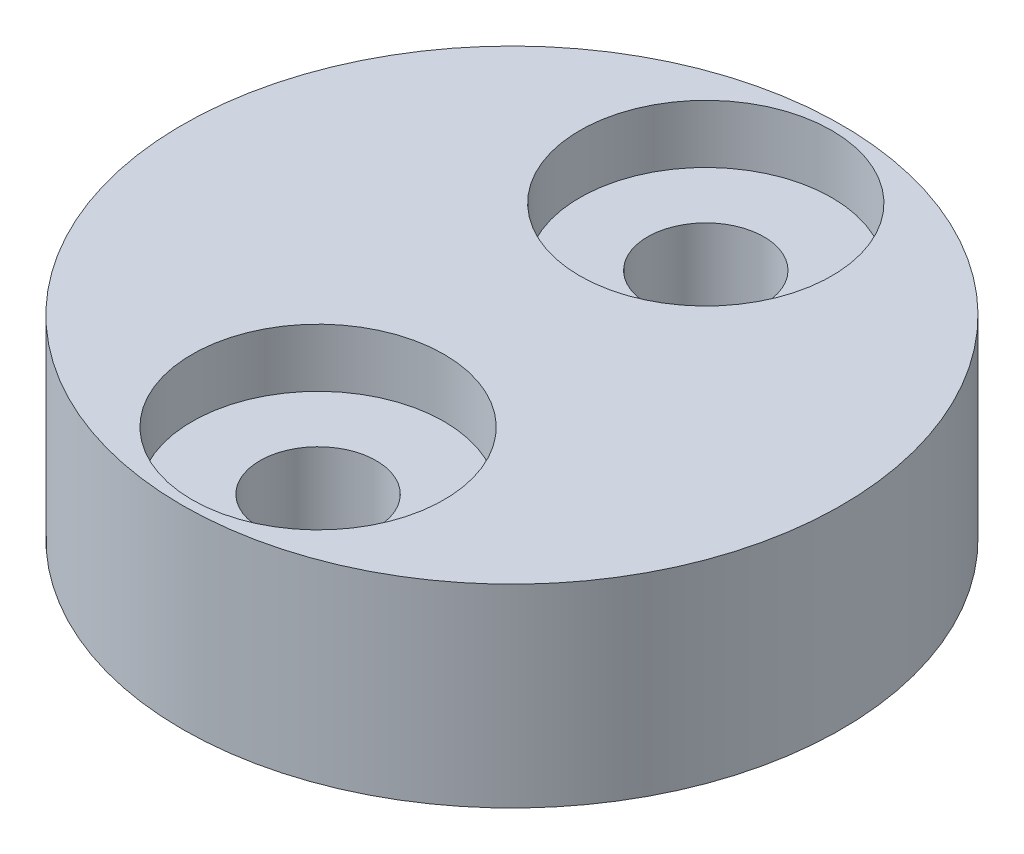
from build123d import *

# Parameters (mm, degrees)
SKETCH1_R           = 8.5
SKETCH1_R_2         = 1.5
BOSS_EXTRUDE1_DEPTH = 5
SKETCH2_R           = 3.25
CUT_EXTRUDE1_DEPTH  = 1.5


with BuildPart() as part:
    # Sketch1 → Boss-Extrude1 (new body)
    with BuildSketch(Plane(origin=(0, 0, 0), x_dir=(1, 0, 0), z_dir=(0, 1, 0))):
        Circle(SKETCH1_R)
        with Locations((0, 5)):
            Circle(SKETCH1_R_2, mode=Mode.SUBTRACT)
        with Locations((0, -5)):
            Circle(SKETCH1_R_2, mode=Mode.SUBTRACT)
    extrude(amount=BOSS_EXTRUDE1_DEPTH)

    # Sketch2 → Cut-Extrude1 (cut)
    with BuildSketch(Plane(origin=(0, 5, 0), x_dir=(1, 0, 0), z_dir=(0, 1, 0))):
        with Locations((0, 5)):
            Circle(SKETCH2_R)
        with Locations((0, -5)):
            Circle(SKETCH2_R)
    extrude(amount=-CUT_EXTRUDE1_DEPTH, mode=Mode.SUBTRACT)


solid = part.part
